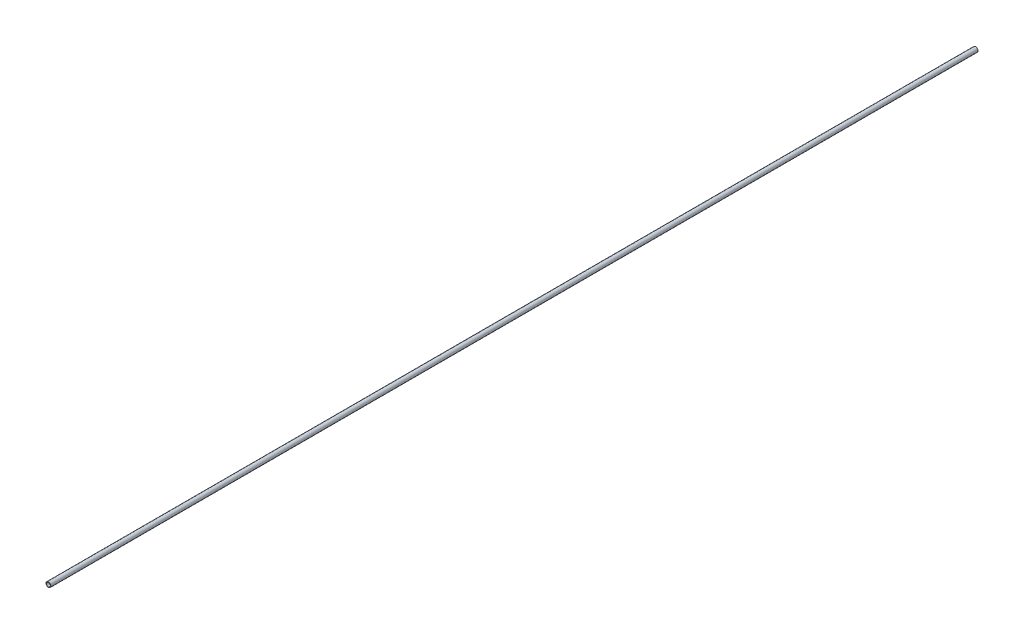
from build123d import *

# Parameters (mm, degrees)
SKETCH1_R      = 16.7005
SKETCH1_R_2    = 13.3223
BASEPIPE_DEPTH = 6426.2


with BuildPart() as part:
    # Sketch1 → BasePipe (new body)
    with BuildSketch(Plane.XY):
        Circle(SKETCH1_R)
        Circle(SKETCH1_R_2, mode=Mode.SUBTRACT)
    extrude(amount=BASEPIPE_DEPTH)


solid = part.part
